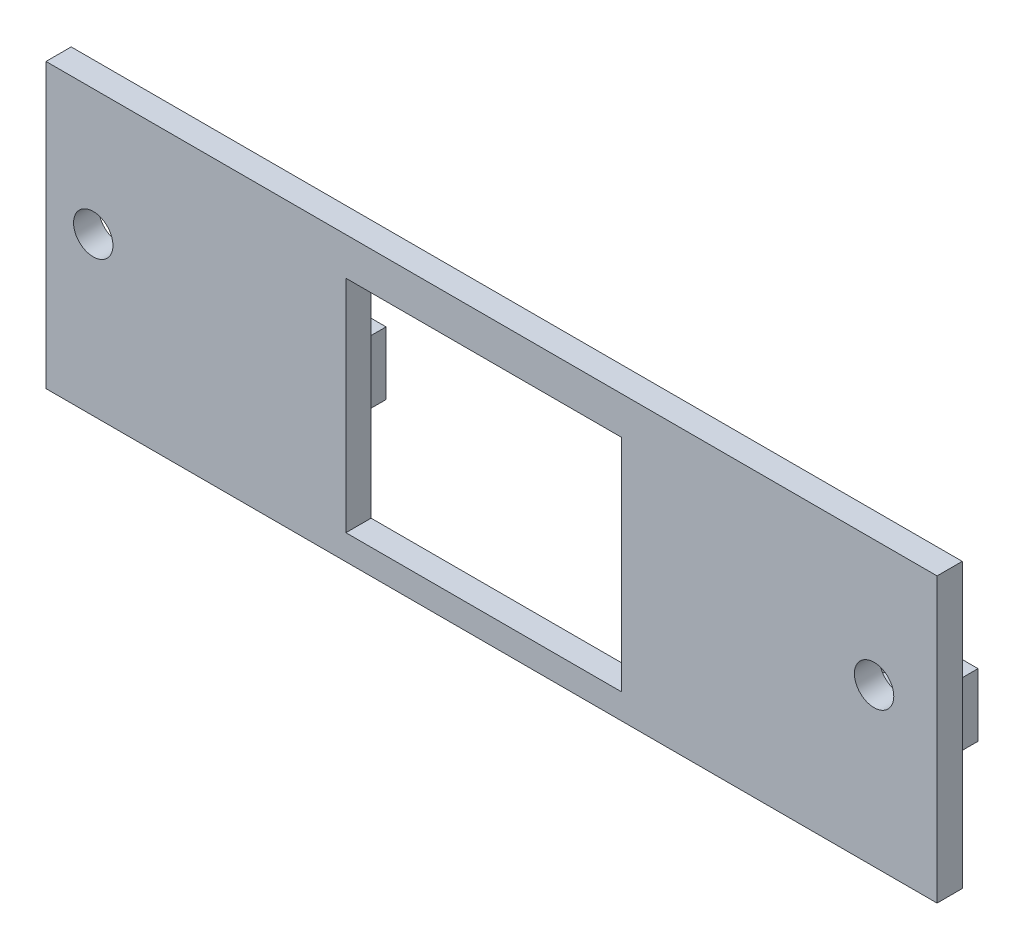
from build123d import *

# Parameters (mm, degrees)
SKETCH1_W               = 57.6
SKETCH1_H               = 18
SKETCH1_R               = 1.25
BOSS_EXTRUDE1_DEPTH     = 1.6
SKETCH7_W               = 8
SKETCH7_H               = 7
SKETCH7_R               = 1.3
BOSS_EXTRUDE3_DEPTH     = 4
BOSS_EXTRUDE3_2_DEPTH   = 4
CUT_EXTRUDE1_DEPTH      = 35.676216633
CUT_EXTRUDE1_DEPTH_BACK = 35.676216633
SKETCH8_W               = 17.5
SKETCH8_H               = 14
FILLET1_R               = 0.5
SKETCH9_W               = 1.6
SKETCH9_H               = 18
MAKEITFITREALITY_DEPTH  = 1


with BuildPart() as part:
    # Sketch1 → Boss-Extrude1 (new body)
    with BuildSketch(Plane.XY):
        with Locations((0, 9)):
            Rectangle(SKETCH1_W, SKETCH1_H)
        with Locations((-24.8, 10)):
            Circle(SKETCH1_R, mode=Mode.SUBTRACT)
        with Locations((24.8, 10)):
            Circle(SKETCH1_R, mode=Mode.SUBTRACT)
    extrude(amount=BOSS_EXTRUDE1_DEPTH)

    # Sketch8 → Cut-Extrude1 (cut, two sides: drawn at the far end of the back side and taken through both)
    with BuildSketch(Plane.XY.offset(-CUT_EXTRUDE1_DEPTH_BACK)):
        with Locations((0, 8.6)):
            Rectangle(SKETCH8_W, SKETCH8_H)
    extrude(amount=CUT_EXTRUDE1_DEPTH + CUT_EXTRUDE1_DEPTH_BACK, mode=Mode.SUBTRACT)


with BuildPart() as body_2:
    # Sketch7 → Boss-Extrude3 (new body)
    with BuildSketch(Plane(origin=(0, 1.6, 0), x_dir=(1, 0, 0), z_dir=(0, 1, 0))):
        with Locations((-18.8, 3.5)):
            Rectangle(SKETCH7_W, SKETCH7_H)
        with Locations((-18.8, 4.2)):
            Circle(SKETCH7_R, mode=Mode.SUBTRACT)
    extrude(amount=BOSS_EXTRUDE3_DEPTH)


with BuildPart() as body_3:
    # Sketch7 → Boss-Extrude3 2 (new body)
    with BuildSketch(Plane(origin=(0, 1.6, 0), x_dir=(1, 0, 0), z_dir=(0, 1, 0))):
        with Locations((18.8, 3.5)):
            Rectangle(SKETCH7_W, SKETCH7_H)
        with Locations((18.8, 4.2)):
            Circle(SKETCH7_R, mode=Mode.SUBTRACT)
    extrude(amount=BOSS_EXTRUDE3_2_DEPTH)


with BuildPart() as body_2_1:
    add(body_2.part)

    # Combine1: union part, body 3
    add(part.part)
    add(body_3.part)

    # Fillet1
    fillet1_edges = [body_2_1.edges().sort_by_distance(p)[0] for p in [
        (-14.8, 3.6, 0),
        (-22.8, 3.6, 0),
        (-18.8, 5.6, 0),
        (14.8, 3.6, 0),
        (22.8, 3.6, 0),
        (18.8, 5.6, 0),
    ]]
    fillet(fillet1_edges, radius=FILLET1_R)

    # Sketch9 → MakeItFitReality (cut)
    with BuildSketch(Plane.ZY.offset(28.8)):
        with Locations((0.8, 9)):
            Rectangle(SKETCH9_W, SKETCH9_H)
    extrude(amount=-MAKEITFITREALITY_DEPTH, mode=Mode.SUBTRACT)


solid = body_2_1.part
